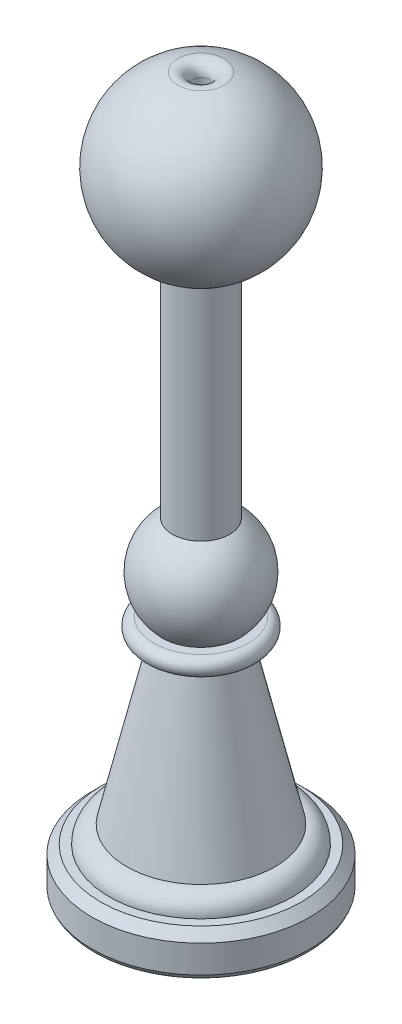
from build123d import *

# Parameters (mm, degrees)
FILLET1_R          = 1.524
CHAMFER1_SIZE      = 0.762
SKETCH5_R          = 0.75
CUT_EXTRUDE1_DEPTH = 65
FILLET2_R          = 1
SKETCH6_R          = 5.1000000000000005
CUT_EXTRUDE2_DEPTH = 4
FILLET3_R          = 1


# Some blends are built 0.0001 mm under size
with BuildPart() as part:
    # Sketch1 → Revolve1 (revolve)
    with BuildSketch(Plane.XY, mode=Mode.PRIVATE) as revolve1_sk:
        with BuildLine():
            Line((0, 0), (-9.525, -1.19e-15))
            Line((-9.525, -1.19e-15), (-9.525, 3.1749999999999985))
            Line((-9.525, 3.1749999999999985), (-8.001000000000001, 3.174999999999999))
            Line((-8.001000000000001, 3.174999999999999), (-8.001000000000001, 4.698999999999999))
            Line((-8.001000000000001, 4.698999999999999), (-6.477000000000001, 4.699))
            Line((-6.477000000000001, 4.699), (-3.1750000000000047, 18.923000000000002))
            Line((-3.1750000000000047, 18.923000000000002), (-4.131690787001095, 18.923000000000002))
            ThreePointArc((-4.131690787001095, 18.923000000000002), (-4.893690787001096, 19.685000000000002), (-4.131690787001095, 20.447000000000003))
            Line((-4.131690787001095, 20.447000000000003), (-3.369690787001095, 20.447000000000003))
            ThreePointArc((-3.369690787001095, 20.447000000000003), (-4.399409051224952, 25.63639864027583), (0, 28.575))
            Line((0, 28.575), (0, 0))
        make_face()
    revolve(revolve1_sk.sketch.rotate(Axis((0, 0, 0), (0, 1, 0)), 270), axis=Axis((0, 0, 0), (0, 1, 0)))

    # Fillet1
    fillet1_edges = [part.edges().sort_by_distance(p)[0] for p in [
        (-2.76e-15, 4.698999999999999, 8.001000000000001),
    ]]
    fillet(fillet1_edges, radius=FILLET1_R - 0.0001)  # a hair under: the kernel refuses the full size

    # Chamfer1
    chamfer1_edges = [part.edges().sort_by_distance(p)[0] for p in [
        (-3.28e-15, 3.1749999999999985, 9.525),
    ]]
    chamfer(chamfer1_edges, length=CHAMFER1_SIZE)

    # Sketch4 → Revolve2 (revolve)
    with BuildSketch(Plane.XY, mode=Mode.PRIVATE) as revolve2_sk:
        with BuildLine():
            ThreePointArc((-2.5000000000000004, 47.32), (-1.268264840443389, 46.99907861446434), (-3.4777e-13, 46.891067811865476))
            Line((-5.67e-15, 46.891067811865476), (-5.67e-15, 47.32))
            Line((0, 47.32), (-2.5, 47.32))
        make_face()
        with BuildLine():
            Line((-2.5, 47.32), (0, 47.32))
            Line((-5.67e-15, 47.32), (-5.77e-15, 61.891067811865476))
            ThreePointArc((7.873e-14, 61.891067811865476), (-7.39198919740116, 55.659332652308734), (-2.5000000000000004, 47.32))
        make_face()
        with BuildLine():
            Line((0, 27.06642499298062), (0, 28.575000000000003))
            Line((-5.54e-15, 28.575000000000003), (-5.67e-15, 46.891067811865476))
            ThreePointArc((-3.4777e-13, 46.891067811865476), (-1.268264840443389, 46.99907861446434), (-2.5000000000000004, 47.32))
            Line((-2.5, 47.32), (-2.5, 27.06642499298062))
            Line((-2.5, 27.06642499298062), (0, 27.06642499298062))
        make_face()
        Polygon((-5.37, -2.68), (0, -2.68), (0, 0), (-10.000000000000009, -1.22e-15), align=None)
    revolve(revolve2_sk.sketch.rotate(Axis((-5.54e-15, 28.575000000000003, 0), (-1e-17, 1, 0)), 180), axis=Axis((-5.54e-15, 28.575000000000003, 0), (-1e-17, 1, 0)))

    # Sketch5 → Cut-Extrude1 (cut)
    with BuildSketch(Plane.XZ.offset(2.6799999999999997)):
        Circle(SKETCH5_R)
    extrude(amount=-CUT_EXTRUDE1_DEPTH, mode=Mode.SUBTRACT)

    # Fillet2
    # the kernel refuses this fillet: 1 mm, written as the material it takes off along each edge
    with BuildSketch(Plane(origin=(-5.34e-15, 0, 0), x_dir=(1, 1e-17, 1.2e-16), z_dir=(-1.2e-16, 0, 1))) as fillet2_piece_1:
        with BuildLine():
            CenterArc((8.582830845240172, 0.3351377087394681), FILLET2_R, 300.06370450944223, 40.35538333384943)
            Line((9.083793429310006, -0.5303312331423737), (10.000000000000004, 0))
            Line((10.000000000000004, 0), (9.525000000000006, -1.29e-15))
        make_face()
    revolve(axis=Axis((-5.34e-15, 0, 0), (-1e-17, 1, 0)), mode=Mode.SUBTRACT)
    with BuildSketch(Plane(origin=(-9.16e-15, 61.85347359016511, 0), x_dir=(1, 0, 1.2e-16), z_dir=(1.2e-16, 0, -1))) as fillet2_piece_2:
        with BuildLine():
            CenterArc((1.7500000000000087, 1.2024137655251934), FILLET2_R, 180, 105.61849827564862)
            ThreePointArc((2.01923076923078, 0.23933807125219886), (1.3897771193257238, 0.09229590404412846), (0.75, 0))
            Line((0.75, 0), (0.7500000000000088, 1.2024137655251934))
        make_face()
    revolve(axis=Axis((-9.16e-15, 61.85347359016511, 0), (1e-17, -1, 0)), mode=Mode.SUBTRACT)

    # Sketch6 → Cut-Extrude2 (cut)
    with BuildSketch(Plane.XZ.offset(2.6799999999999997)):
        Circle(SKETCH6_R)
    extrude(amount=-CUT_EXTRUDE2_DEPTH, mode=Mode.SUBTRACT)

    # Fillet3
    # the kernel refuses this fillet: 1 mm, written as the material it takes off along each edge
    with BuildSketch(Plane(origin=(2e-17, -2.6799999999999997, 0), x_dir=(1, 0, 0), z_dir=(0, 0, -1))) as fillet3_piece_1:
        with BuildLine():
            CenterArc((6.1000000000000005, -0.6834471449936594), FILLET3_R, 136.8863940541022, 43.1136059458978)
            Line((5.1000000000000005, -0.6834471449936594), (5.080000000000001, -0.6834471449936594))
            Line((5.080000000000001, -0.6834471449936594), (5.080000000000001, 0))
            Line((5.080000000000001, 0), (5.1000000000000005, 0.02000000000000002))
            ThreePointArc((5.1000000000000005, 0.02000000000000002), (5.234999999999995, 0.02000000000000002), (5.355399999999989, 0.0136689428998733))
            Line((5.355399999999989, 0.0136689428998733), (5.3699999999999894, 0))
        make_face()
    revolve(axis=Axis((2e-17, -2.6799999999999997, 0), (1e-17, -1, 0)), mode=Mode.SUBTRACT)


solid = part.part
